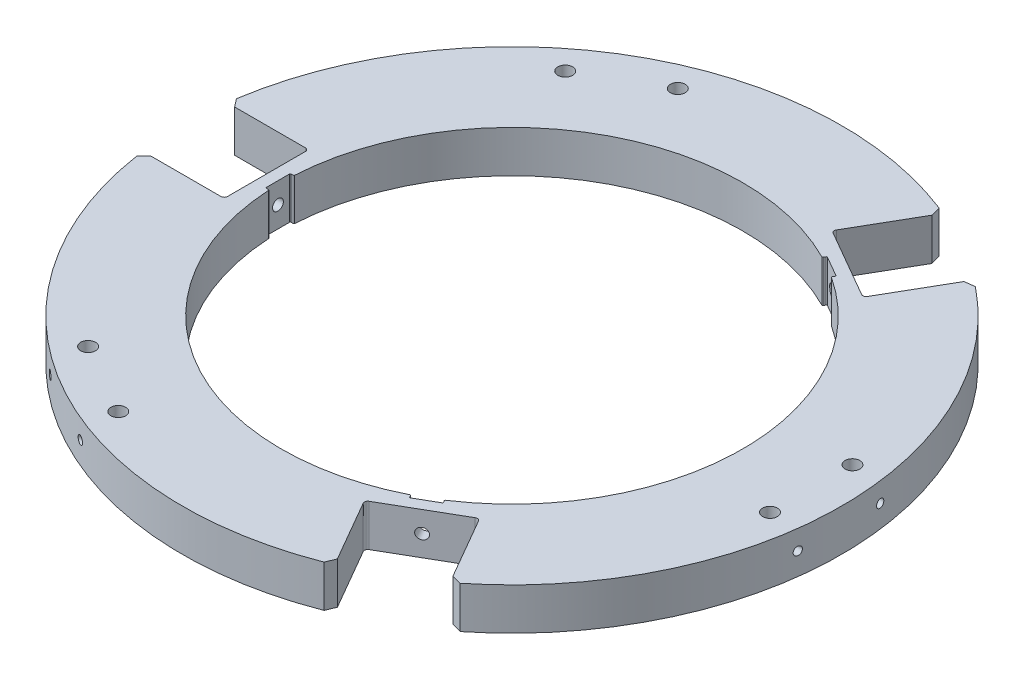
from build123d import *

# Parameters (mm, degrees)
SKETCH1_R                      = 70
BOSS_EXTRUDE2_DEPTH            = 12.7
FILLET1_R                      = 1
CHAMFER1_SIZE                  = 2.232593028
CHAMFER1_SIZE_2                = 2.5
F_3_0MM_DOWEL_HOLE2_REACH      = 215.907
F_3_0MM_DOWEL_HOLE2_BORE_R     = 1.65
CIRPATTERN3_COUNT              = 3
SKETCH8_W                      = 2
SKETCH8_H                      = 7.5
CUT_EXTRUDE1_DEPTH             = 142.990457435
FILLET2_R                      = 0.25
CIRPATTERN4_COUNT              = 3
FILLET2_OF_CIRPATTERN4_R       = 0.25
F_4_0MM_DOWEL_HOLE1_AT_2_COUNT = 2
F_4_0MM_DOWEL_HOLE1_AT_2_PITCH = 25
CIRPATTERN5_COUNT              = 3
M3X0_5_TAPPED_HOLE2_AT_2_COUNT = 2
M3X0_5_TAPPED_HOLE2_AT_2_PITCH = 25
CIRPATTERN6_COUNT              = 3


with BuildPart() as part:
    # Sketch1 → Boss-Extrude2 (new body)
    with BuildSketch(Plane(origin=(0, 0, 0), x_dir=(1, 0, 0), z_dir=(0, 1, 0))):
        with BuildLine():
            ThreePointArc((100, 0), (89.630863423, 44.343075243), (60.673833561, 79.490162417))
            Line((60.673833561, 79.490162417), (48.335125168, 58.118892582))
            Line((48.335125168, 58.118892582), (26.164874832, 70.918892582))
            Line((26.164874832, 70.918892582), (38.503583224, 92.290162417))
            ThreePointArc((38.503583224, 92.290162417), (-50, 86.602540378), (-99.177416784, 12.8))
            Line((-99.177416784, 12.8), (-74.5, 12.8))
            Line((-74.5, 12.8), (-74.5, -12.8))
            Line((-74.5, -12.8), (-99.177416784, -12.8))
            ThreePointArc((-99.177416784, -12.8), (-50, -86.602540378), (38.503583224, -92.290162417))
            Line((38.503583224, -92.290162417), (26.164874832, -70.918892582))
            Line((26.164874832, -70.918892582), (48.335125168, -58.118892582))
            Line((48.335125168, -58.118892582), (60.673833561, -79.490162417))
            ThreePointArc((60.673833561, -79.490162417), (89.630863423, -44.343075243), (100, 0))
        make_face()
        with Locations(Location((0, 0, 0), (0, 0, 270))):
            Circle(SKETCH1_R, mode=Mode.SUBTRACT)
    extrude(amount=BOSS_EXTRUDE2_DEPTH)

    # Fillet1
    fillet1_edges = [part.edges().sort_by_distance(p)[0] for p in [
        (48.335125168, 6.35, 58.118892582),
        (26.164874832, 6.35, 70.918892582),
        (-74.5, 6.35, 12.8),
        (-74.5, 6.35, -12.8),
        (26.164874832, 6.35, -70.918892582),
        (48.335125168, 6.35, -58.118892582),
    ]]
    fillet(fillet1_edges, radius=FILLET1_R)

    # Chamfer1
    # the kernel refuses this chamfer: 2.5, 2.232593028 mm, written as the material it takes off along each edge
    with BuildSketch(Plane(origin=(38.503583224, -6.351330223, 92.290162417), x_dir=(-0.4999999999994457, 0, -0.8660254037847587), z_dir=(0, 1, 0)), Plane(origin=(60.673833561, -6.351330223, -79.490162417), x_dir=(-0.5000000000003051, 0, 0.8660254037842624), z_dir=(0, 1, 0))) as chamfer1_piece_1:
        with BuildLine():
            Line((CHAMFER1_SIZE, 0), (0.346342416, 2.445285803))
            ThreePointArc((0.346342416, 2.445285803), (0.170523224, 1.258272567), (0, 0))
            Line((0, 0), (CHAMFER1_SIZE, 0))
        make_face()
    extrude(amount=25.402660447, mode=Mode.SUBTRACT)
    with BuildSketch(Plane(origin=(-99.177416784, -6.42920747, 12.8), x_dir=(0.13897023449143497, 0, 0.990296558574953), z_dir=(0, 1, 0)), Plane(origin=(60.673833561, -6.42920747, 79.490162417), x_dir=(0.7881368597604604, 0, -0.6155000327269856), z_dir=(0, 1, 0))) as chamfer1_piece_2:
        with BuildLine():
            Line((2.213825834, 0), (CHAMFER1_SIZE_2 * 0.138970234491, CHAMFER1_SIZE_2 * 0.990296558575))
            Line((CHAMFER1_SIZE_2 * 0.138970234491, CHAMFER1_SIZE_2 * 0.990296558575), (0, 0))
            ThreePointArc((0, 0), (1.137001677, -0.006121942), (2.213825834, 0))
        make_face()
    extrude(amount=25.55841494, mode=Mode.SUBTRACT)
    with BuildSketch(Plane(origin=(-99.177416784, -6.351330223, -12.8), x_dir=(0.1402371214073107, 0, -0.9901179474079799), z_dir=(0, 1, 0))) as chamfer1_piece_3:
        with BuildLine():
            Line((2.469691423, 0), (CHAMFER1_SIZE * 0.140237121404, -CHAMFER1_SIZE * 0.990117947384))
            Line((CHAMFER1_SIZE * 0.140237121404, -CHAMFER1_SIZE * 0.990117947384), (0, 0))
            ThreePointArc((0, 0), (1.269751938, 0.007618418), (2.469691423, 0))
        make_face()
    extrude(amount=25.402660447, mode=Mode.SUBTRACT)
    with BuildSketch(Plane(origin=(38.503583224, -6.42920747, -92.290162417), x_dir=(-0.49999999999948913, 0, 0.8660254037847336), z_dir=(0, 1, 0))) as chamfer1_piece_4:
        with BuildLine():
            Line((CHAMFER1_SIZE_2, 0), (0.307655895, -2.192344105))
            ThreePointArc((0.307655895, -2.192344105), (0.151946852, -1.126819615), (0, 0))
            Line((0, 0), (CHAMFER1_SIZE_2, 0))
        make_face()
    extrude(amount=25.55841494, mode=Mode.SUBTRACT)

    # Ø3.0mm Dowel Hole2 bore → Ø3.0mm Dowel Hole2 (cut, up to next)
    with BuildSketch(Plane(origin=(37.25, 0, 64.518892582), x_dir=(0.8660254037844382, 0, -0.500000000000001), z_dir=(0.5000000000000009, 0, 0.866025403784438)), mode=Mode.PRIVATE) as f_3_0mm_dowel_hole2_sk1:
        with Locations((0, 6.35)):
            Circle(F_3_0MM_DOWEL_HOLE2_BORE_R)
    f_3_0mm_dowel_hole2_tool1 = extrude(f_3_0mm_dowel_hole2_sk1.sketch, amount=-F_3_0MM_DOWEL_HOLE2_REACH, mode=Mode.PRIVATE) & part.part
    f_3_0mm_dowel_hole2 = f_3_0mm_dowel_hole2_tool1.solids().sort_by_distance((37.25, 6.35, 64.518893))[0]
    add(f_3_0mm_dowel_hole2, mode=Mode.SUBTRACT)

    # CirPattern3: Ø3.0mm Dowel Hole2 ×3 about axis
    cirpattern3_axis = Axis((0, 12.7, 0), (0, -1, 0))
    for i in range(1, CIRPATTERN3_COUNT):
        add(f_3_0mm_dowel_hole2.rotate(cirpattern3_axis, i * 360 / CIRPATTERN3_COUNT), mode=Mode.SUBTRACT)

    # Sketch8 → Cut-Extrude1 (cut, through all)
    with BuildSketch(Plane(origin=(0, 12.7, 0), x_dir=(1, 0, 0), z_dir=(0, 1, 0))):
        with Locations((-70, 0)):
            Rectangle(SKETCH8_W, SKETCH8_H)
    cut_extrude1 = extrude(amount=-CUT_EXTRUDE1_DEPTH, mode=Mode.SUBTRACT)

    # Fillet2
    fillet2_edges = [part.edges().sort_by_distance(p)[0] for p in [
        (-69.8994814, 6.35, 3.75),
        (-69.8994814, 6.35, -3.75),
        (-71, 6.35, 3.75),
        (-71, 6.35, -3.75),
    ]]
    fillet(fillet2_edges, radius=FILLET2_R)

    # CirPattern4: Cut-Extrude1 ×3 about axis
    cirpattern4_axis = Axis((0, 0, 0), (0, 1, 0))
    for i in range(1, CIRPATTERN4_COUNT):
        add(cut_extrude1.rotate(cirpattern4_axis, i * 360 / CIRPATTERN4_COUNT), mode=Mode.SUBTRACT)

    # Fillet2 of CirPattern4
    fillet2_of_cirpattern4_edges = [part.edges().sort_by_distance(p)[0] for p in [
        (38.197335964, 6.35, 58.659726604),
        (31.702145436, 6.35, 62.409726604),
        (38.747595264, 6.35, 59.612803669),
        (32.252404736, 6.35, 63.362803669),
        (31.702145436, 6.35, -62.409726604),
        (38.197335964, 6.35, -58.659726604),
        (32.252404736, 6.35, -63.362803669),
        (38.747595264, 6.35, -59.612803669),
    ]]
    fillet(fillet2_of_cirpattern4_edges, radius=FILLET2_OF_CIRPATTERN4_R)

    # Sketch12 → Ø4.0mm Dowel Hole1 (revolve, cut)
    with BuildSketch(Plane(origin=(-56.217055782, 12.7, -72.370796867), x_dir=(0, 0, 1), z_dir=(1, 0, 0))):
        Polygon((0, 0), (0, 46.351936393), (2.25, 45), (2.25, 0), align=None)
    f_4_0mm_dowel_hole1 = revolve(axis=Axis((-56.217055782, 19.05, -72.370796867), (0, -1, 0)), mode=Mode.SUBTRACT)

    # Ø4.0mm Dowel Hole1 at 2: Ø4.0mm Dowel Hole1 ×2
    with Locations(*[Vector(0.8660254037844388, 0, -0.49999999999999983) * (i * F_4_0MM_DOWEL_HOLE1_AT_2_PITCH) for i in range(1, F_4_0MM_DOWEL_HOLE1_AT_2_COUNT)]):
        add(f_4_0mm_dowel_hole1, mode=Mode.SUBTRACT)

    # CirPattern5: Ø4.0mm Dowel Hole1 ×3 about axis
    cirpattern5_axis = Axis((0, 0, 0), (0, 1, 0))
    for i in range(1, CIRPATTERN5_COUNT):
        add(f_4_0mm_dowel_hole1.rotate(cirpattern5_axis, i * 360 / CIRPATTERN5_COUNT), mode=Mode.SUBTRACT)

    # CirPattern5 copy 1 sketch → CirPattern5 copy 1 (revolve, cut)
    with BuildSketch(Plane(origin=(-56.217055782, 12.7, 72.370796867), x_dir=(0.8660254037844387, 0, -0.4999999999999998), z_dir=(-0.4999999999999998, 0, -0.8660254037844387))):
        Polygon((0, 0), (0, 46.351936393), (2.25, 45), (2.25, 0), align=None)
    revolve(axis=Axis((-56.217055782, 19.05, 72.370796867), (0, -1, 0)), mode=Mode.SUBTRACT)

    # CirPattern5 copy 2 sketch → CirPattern5 copy 2 (revolve, cut)
    with BuildSketch(Plane(origin=(90.78347647, 12.7, 12.5), x_dir=(-0.8660254037844384, 0, -0.5000000000000004), z_dir=(-0.5000000000000004, 0, 0.8660254037844384))):
        Polygon((0, 0), (0, 46.351936393), (2.25, 45), (2.25, 0), align=None)
    revolve(axis=Axis((90.78347647, 19.05, 12.5), (0, -1, 0)), mode=Mode.SUBTRACT)

    # Sketch15 → M3x0.5 Tapped Hole2 (revolve, cut)
    with BuildSketch(Plane(origin=(89, 6.776295675, 12.5), x_dir=(0, 0, 1), z_dir=(0, 1, 0))):
        Polygon((0, 0), (0, 18.251075774), (1.25, 17.5), (1.25, 0), align=None)
    m3x0_5_tapped_hole2 = revolve(axis=Axis((82.65, 6.776295675, 12.5), (1, 0, 0)), mode=Mode.SUBTRACT)

    # M3x0.5 Tapped Hole2 at 2: M3x0.5 Tapped Hole2 ×2
    with Locations(*[(0, 0, -i * M3X0_5_TAPPED_HOLE2_AT_2_PITCH) for i in range(1, M3X0_5_TAPPED_HOLE2_AT_2_COUNT)]):
        add(m3x0_5_tapped_hole2, mode=Mode.SUBTRACT)

    # CirPattern6: M3x0.5 Tapped Hole2 ×3 about axis
    cirpattern6_axis = Axis((0, 12.7, 0), (0, -1, 0))
    for i in range(1, CIRPATTERN6_COUNT):
        add(m3x0_5_tapped_hole2.rotate(cirpattern6_axis, i * 360 / CIRPATTERN6_COUNT), mode=Mode.SUBTRACT)

    # CirPattern6 copy 1 sketch → CirPattern6 copy 1 (revolve, cut)
    with BuildSketch(Plane(origin=(-33.674682453, 6.776295675, 83.326260937), x_dir=(-0.8660254037844387, 0, -0.4999999999999998), z_dir=(0, 1, 0))):
        Polygon((0, 0), (0, 18.251075774), (1.25, 17.5), (1.25, 0), align=None)
    revolve(axis=Axis((-30.499682453, 6.776295675, 77.826999623), (-0.4999999999999998, 0, 0.8660254037844387)), mode=Mode.SUBTRACT)

    # CirPattern6 copy 2 sketch → CirPattern6 copy 2 (revolve, cut)
    with BuildSketch(Plane(origin=(-55.325317547, 6.776295675, -70.826260937), x_dir=(0.8660254037844384, 0, -0.5000000000000004), z_dir=(0, 1, 0))):
        Polygon((0, 0), (0, 18.251075774), (1.25, 17.5), (1.25, 0), align=None)
    revolve(axis=Axis((-52.150317547, 6.776295675, -65.326999623), (-0.5000000000000004, 0, -0.8660254037844384)), mode=Mode.SUBTRACT)


solid = part.part
